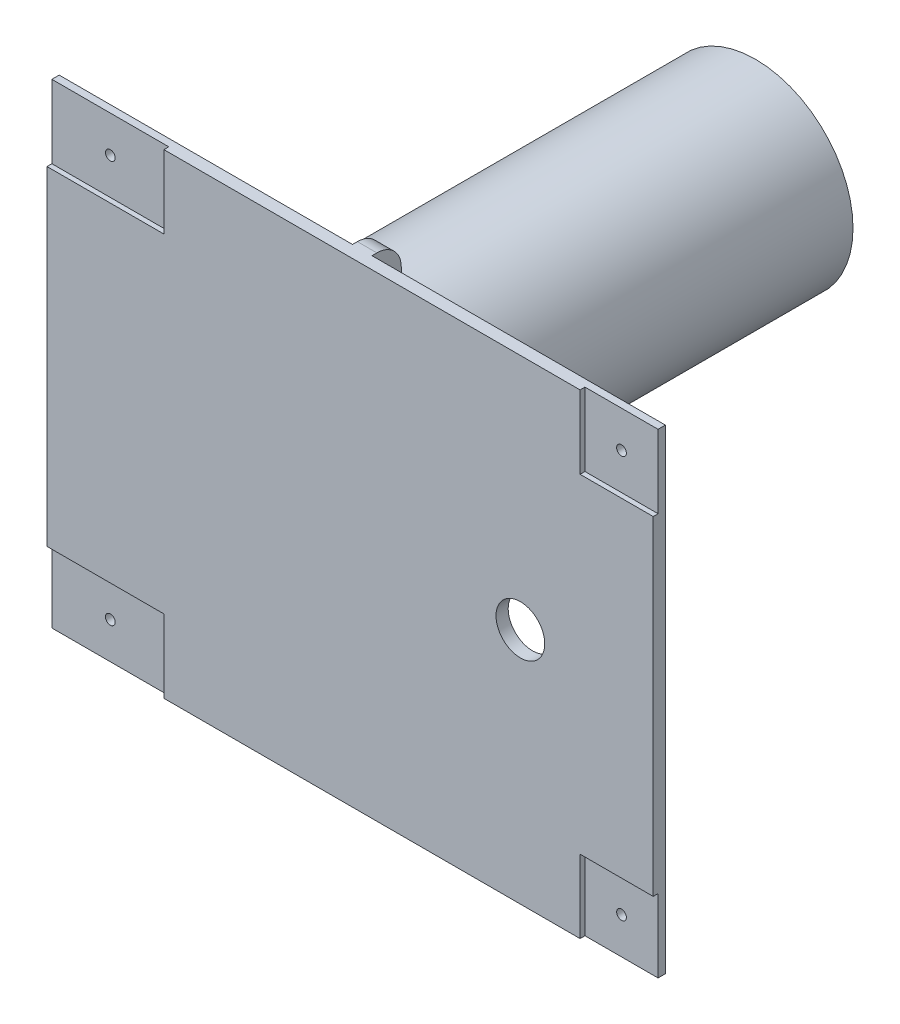
from build123d import *

# Parameters (mm, degrees)
CROQUIS1_W                 = 248.76
CROQUIS1_H                 = 195
SALIENTE_EXTRUIR1_DEPTH    = 5
CROQUIS2_W                 = 48
CROQUIS2_H                 = 30
CROQUIS2_W_2               = 30
CORTAR_EXTRUIR1_DEPTH      = 2
CROQUIS3_R                 = 2
CORTAR_EXTRUIR2_DEPTH      = 10
CROQUIS4_R                 = 40
SALIENTE_EXTRUIR2_DEPTH    = 206
CROQUIS5_R                 = 10
CORTAR_EXTRUIR3_DEPTH      = 10
CROQUIS12_W                = 12
CROQUIS12_H                = 30
SALIENTE_EXTRUIR3_DEPTH    = 4
REDONDEO1_R                = 10
REDONDEO2_R                = 10
REDONDEO3_R                = 10
CORTAR_EXTRUIR5_DEPTH      = 262.677217236
CORTAR_EXTRUIR5_DEPTH_BACK = 262.677217236
CROQUIS13_R                = 1.625


with BuildPart() as part:
    # Croquis1 → Saliente-Extruir1 (new body)
    with BuildSketch(Plane.XY):
        with Locations((7.088293187, 0.26268)):
            Rectangle(CROQUIS1_W, CROQUIS1_H)
    extrude(amount=SALIENTE_EXTRUIR1_DEPTH)

    # Croquis2 → Cortar-Extruir1 (cut)
    with BuildSketch(Plane.XY.offset(5)):
        with Locations((-93.291706813, -82.23732)):
            Rectangle(CROQUIS2_W, CROQUIS2_H)
        with Locations((116.468293187, 82.76268)):
            Rectangle(CROQUIS2_W_2, CROQUIS2_H)
        with Locations((116.468293187, -82.23732)):
            Rectangle(CROQUIS2_W_2, CROQUIS2_H)
        with Locations((-93.291706813, 82.76268)):
            Rectangle(CROQUIS2_W, CROQUIS2_H)
    extrude(amount=-CORTAR_EXTRUIR1_DEPTH, mode=Mode.SUBTRACT)

    # Croquis3 → Cortar-Extruir2 (cut)
    with BuildSketch(Plane.XY.offset(5)):
        with Locations((-93.291706813, 82.76268)):
            Circle(CROQUIS3_R)
        with Locations((-93.291706813, -82.23732)):
            Circle(CROQUIS3_R)
        with Locations((116.468293187, 82.76268)):
            Circle(CROQUIS3_R)
        with Locations((116.468293187, -82.23732)):
            Circle(CROQUIS3_R)
    extrude(amount=-CORTAR_EXTRUIR2_DEPTH, mode=Mode.SUBTRACT)

    # Croquis4 → Saliente-Extruir2 (add)
    with BuildSketch(Plane(origin=(0, 0, 0), x_dir=(-1, 0, 0), z_dir=(0, 0, -1))):
        with Locations((37.531706813, 0.26268)):
            Circle(CROQUIS4_R)
    extrude(amount=SALIENTE_EXTRUIR2_DEPTH)

    # Croquis5 → Cortar-Extruir3 (cut)
    with BuildSketch(Plane(origin=(0, 0, 0), x_dir=(-1, 0, 0), z_dir=(0, 0, -1))):
        with Locations((-76.968293187, 0.26268)):
            Circle(CROQUIS5_R)
    extrude(amount=-CORTAR_EXTRUIR3_DEPTH, mode=Mode.SUBTRACT)

    # Croquis12 → Saliente-Extruir3 (add, symmetric)
    with BuildSketch(Plane(origin=(7.088293187, 0, 0), x_dir=(0, 0, -1), z_dir=(1, 0, 0))):
        with Locations((6, 82.76268)):
            Rectangle(CROQUIS12_W, CROQUIS12_H)
        with Locations((6, -82.23732)):
            Rectangle(CROQUIS12_W, CROQUIS12_H)
    extrude(amount=SALIENTE_EXTRUIR3_DEPTH, both=True)

    # Redondeo1
    redondeo1_edges = [part.edges().sort_by_distance(p)[0] for p in [
        (7.088293187, -67.23732, 0),
        (7.088293187, 67.76268, 0),
    ]]
    fillet(redondeo1_edges, radius=REDONDEO1_R)

    # Redondeo2
    redondeo2_edges = [part.edges().sort_by_distance(p)[0] for p in [
        (7.088293187, 67.76268, -12),
        (7.088293187, -67.23732, -12),
    ]]
    fillet(redondeo2_edges, radius=REDONDEO2_R)

    # Redondeo3
    redondeo3_edges = [part.edges().sort_by_distance(p)[0] for p in [
        (7.088293187, -97.23732, -12),
        (7.088293187, 97.76268, -12),
    ]]
    fillet(redondeo3_edges, radius=REDONDEO3_R)

    # Croquis13 → Cortar-Extruir5 (cut, two sides: drawn at the far end of the back side and taken through both)
    with BuildSketch(Plane(origin=(11.088293187, 0, 0), x_dir=(0, 0, -1), z_dir=(1, 0, 0)).offset(-CORTAR_EXTRUIR5_DEPTH_BACK)):
        with Locations((6, 87.76268)):
            Circle(CROQUIS13_R)
        with Locations((6, 77.76268)):
            Circle(CROQUIS13_R)
        with Locations((6, -77.23732)):
            Circle(CROQUIS13_R)
        with Locations((6, -87.23732)):
            Circle(CROQUIS13_R)
    extrude(amount=CORTAR_EXTRUIR5_DEPTH + CORTAR_EXTRUIR5_DEPTH_BACK, mode=Mode.SUBTRACT)


solid = part.part
